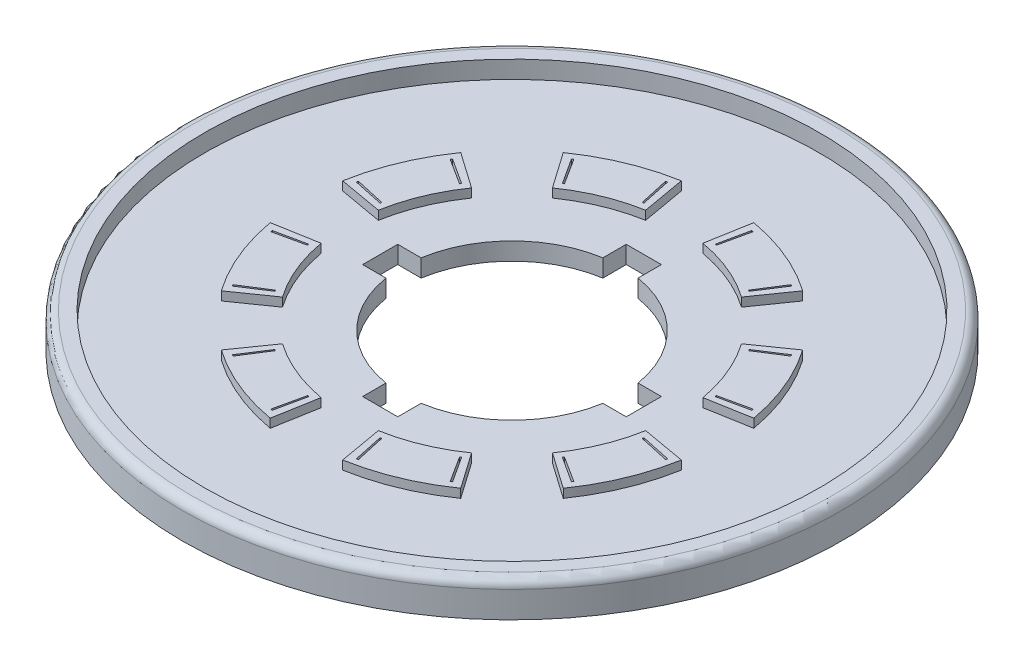
from build123d import *

# Parameters (mm, degrees)
CROQUIS1_R              = 75
SALIENTE_EXTRUIR1_DEPTH = 4
CROQUIS3_R              = 75
CROQUIS3_R_2            = 70
SALIENTE_EXTRUIR2_DEPTH = 4
CROQUIS2_R              = 2.5
CORTAR_EXTRUIR1_DEPTH   = 2
CROQUIS4_R              = 25
CORTAR_EXTRUIR2_DEPTH   = 6
SALIENTE_EXTRUIR4_DEPTH = 2
CORTAR_EXTRUIR3_DEPTH   = 11
REDONDEO1_R             = 2
CORTAR_EXTRUIR4_START   = -10
CORTAR_EXTRUIR4_DEPTH   = 10


with BuildPart() as part:
    # Croquis1 → Saliente-Extruir1 (new body)
    with BuildSketch(Plane(origin=(0, 0, 0), x_dir=(1, 0, 0), z_dir=(0, 1, 0))):
        Circle(CROQUIS1_R)
    extrude(amount=SALIENTE_EXTRUIR1_DEPTH)

    # Croquis3 → Saliente-Extruir2 (add)
    with BuildSketch(Plane(origin=(0, 4, 0), x_dir=(1, 0, 0), z_dir=(0, 1, 0))):
        Circle(CROQUIS3_R)
        Circle(CROQUIS3_R_2, mode=Mode.SUBTRACT)
    extrude(amount=SALIENTE_EXTRUIR2_DEPTH)

    # Croquis2 → Cortar-Extruir1 (cut)
    with BuildSketch(Plane.XZ):
        with Locations((-55.432771951, 22.961005942)):
            Circle(CROQUIS2_R)
        with Locations((-22.961005942, 55.432771951)):
            Circle(CROQUIS2_R)
        with Locations((22.961005942, 55.432771951)):
            Circle(CROQUIS2_R)
        with Locations((55.432771951, 22.961005942)):
            Circle(CROQUIS2_R)
        with Locations((55.432771951, -22.961005942)):
            Circle(CROQUIS2_R)
        with Locations((22.961005942, -55.432771951)):
            Circle(CROQUIS2_R)
        with Locations((-22.961005942, -55.432771951)):
            Circle(CROQUIS2_R)
        with Locations((-55.432771951, -22.961005942)):
            Circle(CROQUIS2_R)
    extrude(amount=-CORTAR_EXTRUIR1_DEPTH, mode=Mode.SUBTRACT)

    # Croquis4 → Cortar-Extruir2 (cut)
    with BuildSketch(Plane.XZ):
        Circle(CROQUIS4_R)
    extrude(amount=-CORTAR_EXTRUIR2_DEPTH, mode=Mode.SUBTRACT)

    # Croquis8 → Saliente-Extruir4 (add)
    with BuildSketch(Plane(origin=(0, 4, 0), x_dir=(1, 0, 0), z_dir=(0, 1, 0))):
        with BuildLine():
            Line((-46.778368268, -8.248288439), (-36.930290738, -6.511806663))
            ThreePointArc((-36.930290738, -6.511806663), (-34.645482469, -14.350628714), (-30.718201661, -21.509116363))
            Line((-30.718201661, -21.509116363), (-38.909722104, -27.244880727))
            ThreePointArc((-38.909722104, -27.244880727), (-43.884277794, -18.177463037), (-46.778368268, -8.248288439))
        make_face()
        with BuildLine():
            Line((-38.909722104, 27.244880727), (-30.718201661, 21.509116363))
            ThreePointArc((-30.718201661, 21.509116363), (-34.645482469, 14.350628714), (-36.930290738, 6.511806663))
            Line((-36.930290738, 6.511806663), (-46.778368268, 8.248288439))
            ThreePointArc((-46.778368268, 8.248288439), (-43.884277794, 18.177463037), (-38.909722104, 27.244880727))
        make_face()
        with BuildLine():
            Line((-8.248288439, 46.778368268), (-6.511806663, 36.930290738))
            ThreePointArc((-6.511806663, 36.930290738), (-14.350628714, 34.645482469), (-21.509116363, 30.718201661))
            Line((-21.509116363, 30.718201661), (-27.244880727, 38.909722104))
            ThreePointArc((-27.244880727, 38.909722104), (-18.177463037, 43.884277794), (-8.248288439, 46.778368268))
        make_face()
        with BuildLine():
            Line((27.244880727, 38.909722104), (21.509116363, 30.718201661))
            ThreePointArc((21.509116363, 30.718201661), (14.350628714, 34.645482469), (6.511806663, 36.930290738))
            Line((6.511806663, 36.930290738), (8.248288439, 46.778368268))
            ThreePointArc((8.248288439, 46.778368268), (18.177463037, 43.884277794), (27.244880727, 38.909722104))
        make_face()
        with BuildLine():
            Line((46.778368268, 8.248288439), (36.930290738, 6.511806663))
            ThreePointArc((36.930290738, 6.511806663), (34.645482469, 14.350628714), (30.718201661, 21.509116363))
            Line((30.718201661, 21.509116363), (38.909722104, 27.244880727))
            ThreePointArc((38.909722104, 27.244880727), (43.884277794, 18.177463037), (46.778368268, 8.248288439))
        make_face()
        with BuildLine():
            Line((38.909722104, -27.244880727), (30.718201661, -21.509116363))
            ThreePointArc((30.718201661, -21.509116363), (34.645482469, -14.350628714), (36.930290738, -6.511806663))
            Line((36.930290738, -6.511806663), (46.778368268, -8.248288439))
            ThreePointArc((46.778368268, -8.248288439), (43.884277794, -18.177463037), (38.909722104, -27.244880727))
        make_face()
        with BuildLine():
            Line((8.248288439, -46.778368268), (6.511806663, -36.930290738))
            ThreePointArc((6.511806663, -36.930290738), (14.350628714, -34.645482469), (21.509116363, -30.718201661))
            Line((21.509116363, -30.718201661), (27.244880727, -38.909722104))
            ThreePointArc((27.244880727, -38.909722104), (18.177463037, -43.884277794), (8.248288439, -46.778368268))
        make_face()
        with BuildLine():
            Line((-27.244880727, -38.909722104), (-21.509116363, -30.718201661))
            ThreePointArc((-21.509116363, -30.718201661), (-14.350628714, -34.645482469), (-6.511806663, -36.930290738))
            Line((-6.511806663, -36.930290738), (-8.248288439, -46.778368268))
            ThreePointArc((-8.248288439, -46.778368268), (-18.177463037, -43.884277794), (-27.244880727, -38.909722104))
        make_face()
    extrude(amount=SALIENTE_EXTRUIR4_DEPTH)

    # Croquis10 → Cortar-Extruir3 (cut)
    with BuildSketch(Plane(origin=(0, 6, 0), x_dir=(1, 0, 0), z_dir=(0, 1, 0))):
        with BuildLine():
            Line((-44.994789634, -9.563937778), (-38.147756429, -8.108555942))
            ThreePointArc((-38.147756429, -8.108555942), (-38.112013152, -8.274929214), (-38.075544278, -8.441144944))
            Line((-38.075544278, -8.441144944), (-44.909616328, -9.956222241))
            ThreePointArc((-44.909616328, -9.956222241), (-44.952630897, -9.760172919), (-44.994789634, -9.563937778))
        make_face()
        with BuildLine():
            Line((-38.578846125, -25.053395611), (-32.70815215, -21.240922366))
            ThreePointArc((-32.70815215, -21.240922366), (-32.800521506, -21.098004383), (-32.892266387, -20.954684726))
            Line((-32.892266387, -20.954684726), (-38.796006507, -24.715781984))
            ThreePointArc((-38.796006507, -24.715781984), (-38.687794596, -24.884825683), (-38.578846125, -25.053395611))
        make_face()
        with BuildLine():
            Line((-38.796006507, 24.715781984), (-32.892266387, 20.954684726))
            ThreePointArc((-32.892266387, 20.954684726), (-32.800521506, 21.098004383), (-32.70815215, 21.240922366))
            Line((-32.70815215, 21.240922366), (-38.578846125, 25.053395611))
            ThreePointArc((-38.578846125, 25.053395611), (-38.687794596, 24.884825683), (-38.796006507, 24.715781984))
        make_face()
        with BuildLine():
            Line((-44.994789634, 9.563937778), (-38.147756429, 8.108555942))
            ThreePointArc((-38.147756429, 8.108555942), (-38.112013152, 8.274929214), (-38.075544278, 8.441144944))
            Line((-38.075544278, 8.441144944), (-44.909616328, 9.956222241))
            ThreePointArc((-44.909616328, 9.956222241), (-44.952630897, 9.760172919), (-44.994789634, 9.563937778))
        make_face()
        with BuildLine():
            Line((-9.956222241, 44.909616328), (-8.441144944, 38.075544278))
            ThreePointArc((-8.441144944, 38.075544278), (-8.274929214, 38.112013152), (-8.108555942, 38.147756429))
            Line((-8.108555942, 38.147756429), (-9.563937778, 44.994789634))
            ThreePointArc((-9.563937778, 44.994789634), (-9.760172919, 44.952630897), (-9.956222241, 44.909616328))
        make_face()
        with BuildLine():
            Line((-25.053395611, 38.578846126), (-21.240922366, 32.70815215))
            ThreePointArc((-21.240922366, 32.70815215), (-21.098004383, 32.800521506), (-20.954684726, 32.892266387))
            Line((-20.954684726, 32.892266387), (-24.715781984, 38.796006507))
            ThreePointArc((-24.715781984, 38.796006507), (-24.884825683, 38.687794596), (-25.053395611, 38.578846126))
        make_face()
        with BuildLine():
            Line((24.715781984, 38.796006507), (20.954684726, 32.892266387))
            ThreePointArc((20.954684726, 32.892266387), (21.098004383, 32.800521506), (21.240922366, 32.70815215))
            Line((21.240922366, 32.70815215), (25.053395611, 38.578846126))
            ThreePointArc((25.053395611, 38.578846126), (24.884825683, 38.687794596), (24.715781984, 38.796006507))
        make_face()
        with BuildLine():
            Line((9.563937778, 44.994789634), (8.108555942, 38.147756429))
            ThreePointArc((8.108555942, 38.147756429), (8.274929214, 38.112013152), (8.441144944, 38.075544278))
            Line((8.441144944, 38.075544278), (9.956222241, 44.909616328))
            ThreePointArc((9.956222241, 44.909616328), (9.760172919, 44.952630897), (9.563937778, 44.994789634))
        make_face()
        with BuildLine():
            Line((44.909616328, 9.956222241), (38.075544278, 8.441144944))
            ThreePointArc((38.075544278, 8.441144944), (38.112013152, 8.274929214), (38.147756429, 8.108555942))
            Line((38.147756429, 8.108555942), (44.994789634, 9.563937778))
            ThreePointArc((44.994789634, 9.563937778), (44.952630897, 9.760172919), (44.909616328, 9.956222241))
        make_face()
        with BuildLine():
            Line((38.578846126, 25.053395611), (32.70815215, 21.240922366))
            ThreePointArc((32.70815215, 21.240922366), (32.800521506, 21.098004383), (32.892266387, 20.954684726))
            Line((32.892266387, 20.954684726), (38.796006507, 24.715781984))
            ThreePointArc((38.796006507, 24.715781984), (38.687794596, 24.884825683), (38.578846126, 25.053395611))
        make_face()
        with BuildLine():
            Line((38.796006507, -24.715781984), (32.892266387, -20.954684726))
            ThreePointArc((32.892266387, -20.954684726), (32.800521506, -21.098004383), (32.70815215, -21.240922366))
            Line((32.70815215, -21.240922366), (38.578846126, -25.053395611))
            ThreePointArc((38.578846126, -25.053395611), (38.687794596, -24.884825683), (38.796006507, -24.715781984))
        make_face()
        with BuildLine():
            Line((44.994789634, -9.563937778), (38.147756429, -8.108555942))
            ThreePointArc((38.147756429, -8.108555942), (38.112013152, -8.274929214), (38.075544278, -8.441144944))
            Line((38.075544278, -8.441144944), (44.909616328, -9.956222241))
            ThreePointArc((44.909616328, -9.956222241), (44.952630897, -9.760172919), (44.994789634, -9.563937778))
        make_face()
        with BuildLine():
            Line((9.956222241, -44.909616328), (8.441144944, -38.075544278))
            ThreePointArc((8.441144944, -38.075544278), (8.274929214, -38.112013152), (8.108555942, -38.147756429))
            Line((8.108555942, -38.147756429), (9.563937778, -44.994789634))
            ThreePointArc((9.563937778, -44.994789634), (9.760172919, -44.952630897), (9.956222241, -44.909616328))
        make_face()
        with BuildLine():
            Line((25.053395611, -38.578846126), (21.240922366, -32.70815215))
            ThreePointArc((21.240922366, -32.70815215), (21.098004383, -32.800521506), (20.954684726, -32.892266387))
            Line((20.954684726, -32.892266387), (24.715781984, -38.796006507))
            ThreePointArc((24.715781984, -38.796006507), (24.884825683, -38.687794596), (25.053395611, -38.578846126))
        make_face()
        with BuildLine():
            Line((-24.715781984, -38.796006507), (-20.954684726, -32.892266387))
            ThreePointArc((-20.954684726, -32.892266387), (-21.098004383, -32.800521506), (-21.240922366, -32.70815215))
            Line((-21.240922366, -32.70815215), (-25.053395611, -38.578846126))
            ThreePointArc((-25.053395611, -38.578846126), (-24.884825683, -38.687794596), (-24.715781984, -38.796006507))
        make_face()
        with BuildLine():
            Line((-9.563937778, -44.994789634), (-8.108555942, -38.147756429))
            ThreePointArc((-8.108555942, -38.147756429), (-8.274929214, -38.112013152), (-8.441144944, -38.075544278))
            Line((-8.441144944, -38.075544278), (-9.956222241, -44.909616328))
            ThreePointArc((-9.956222241, -44.909616328), (-9.760172919, -44.952630897), (-9.563937778, -44.994789634))
        make_face()
    extrude(amount=-CORTAR_EXTRUIR3_DEPTH, mode=Mode.SUBTRACT)

    # Redondeo1
    redondeo1_edges = [part.edges().sort_by_distance(p)[0] for p in [
        (-75, 8, 0),
    ]]
    fillet(redondeo1_edges, radius=REDONDEO1_R)

    # Croquis11 → Cortar-Extruir4 (cut)
    with BuildSketch(Plane(origin=(0, 4, 0), x_dir=(1, 0, 0), z_dir=(0, 1, 0)).offset(CORTAR_EXTRUIR4_START)):
        with BuildLine():
            Line((-4, -24.677925359), (-4, -30))
            Line((-4, -30), (4, -30))
            Line((4, -30), (4, -24.677925359))
            ThreePointArc((4, -24.677925359), (0, -25), (-4, -24.677925359))
        make_face()
        with BuildLine():
            Line((-30, -4), (-24.677925359, -4))
            ThreePointArc((-24.677925359, -4), (-25, 0), (-24.677925359, 4))
            Line((-24.677925359, 4), (-30, 4))
            Line((-30, 4), (-30, -4))
        make_face()
        with BuildLine():
            ThreePointArc((24.677925359, 4), (25, 0), (24.677925359, -4))
            Line((24.677925359, -4), (30, -4))
            Line((30, -4), (30, 4))
            Line((30, 4), (24.677925359, 4))
        make_face()
        with BuildLine():
            Line((-4, 30), (-4, 24.677925359))
            ThreePointArc((-4, 24.677925359), (0, 25), (4, 24.677925359))
            Line((4, 24.677925359), (4, 30))
            Line((4, 30), (-4, 30))
        make_face()
    extrude(amount=CORTAR_EXTRUIR4_DEPTH, mode=Mode.SUBTRACT)


solid = part.part
